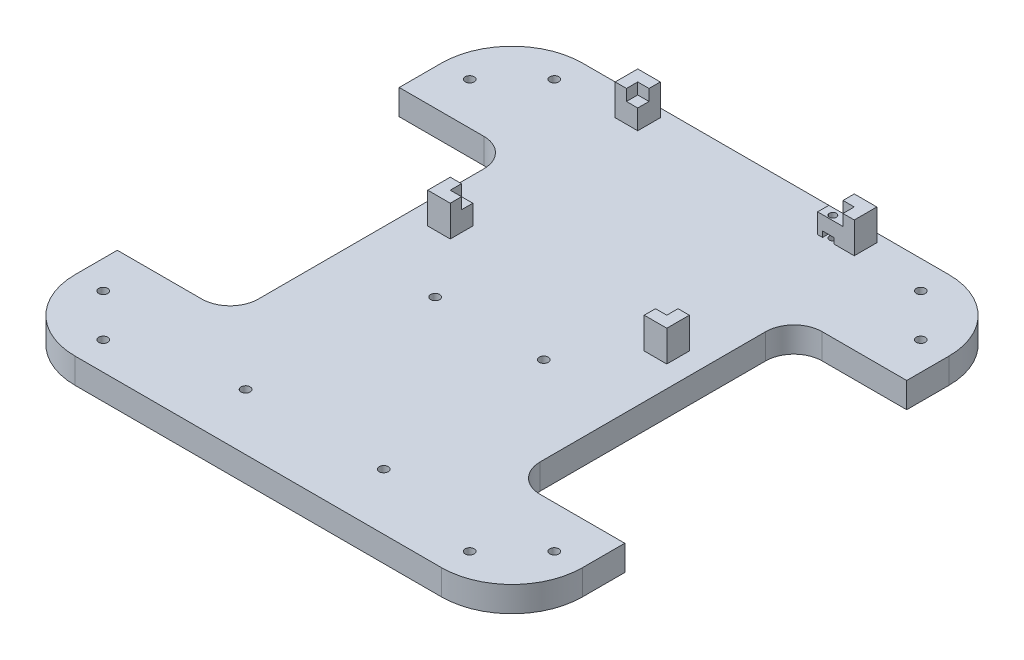
from build123d import *

# Parameters (mm, degrees)
PLATE_DEPTH         = 9
SKETCH3_R           = 1.6
HEX_HOLES_DEPTH     = 128.597021909
SKETCH4_R           = 1.6
ARDUINO_HOLES_DEPTH = 128.597021909
SKETCH5_W           = 40
SKETCH5_H           = 100
CUT_EXTRUDE1_DEPTH  = 128.597021909
FILLET1_R           = 10
BOSS_EXTRUDE1_DEPTH = 11
SKETCH7_W           = 4
SKETCH7_H           = 4
SKETCH7_W_2         = 9
BOSS_EXTRUDE2_DEPTH = 7
SKETCH8_R           = 1.25
CUT_EXTRUDE2_DEPTH  = 129.280941687
SKETCH9_W           = 4
SKETCH9_H           = 2
CUT_EXTRUDE3_DEPTH  = 193.512337267


with BuildPart() as part:
    # Sketch1 → Plate (new body)
    with BuildSketch(Plane(origin=(0, 0, 0), x_dir=(1, 0, 0), z_dir=(0, 1, 0))):
        with BuildLine():
            Line((-65, -90), (65, -90))
            ThreePointArc((65, -90), (82.67766953, -82.67766953), (90, -65))
            Line((90, -65), (90, 65))
            ThreePointArc((90, 65), (82.67766953, 82.67766953), (65, 90))
            Line((65, 90), (-65, 90))
            ThreePointArc((-65, 90), (-82.67766953, 82.67766953), (-90, 65))
            Line((-90, 65), (-90, -65))
            ThreePointArc((-90, -65), (-82.67766953, -82.67766953), (-65, -90))
        make_face()
    extrude(amount=PLATE_DEPTH)

    # Sketch3 → Hex Holes (cut, through all)
    with BuildSketch(Plane(origin=(0, 9, 0), x_dir=(1, 0, 0), z_dir=(0, 1, 0))):
        with Locations((-65, 80)):
            Circle(SKETCH3_R)
        with Locations((-80, 65)):
            Circle(SKETCH3_R)
        with Locations((80, 65)):
            Circle(SKETCH3_R)
        with Locations((80, -65)):
            Circle(SKETCH3_R)
        with Locations((65, 80)):
            Circle(SKETCH3_R)
        with Locations((65, -80)):
            Circle(SKETCH3_R)
        with Locations((-65, -80)):
            Circle(SKETCH3_R)
        with Locations((-80, -65)):
            Circle(SKETCH3_R)
    extrude(amount=-HEX_HOLES_DEPTH, mode=Mode.SUBTRACT)

    # Sketch4 → Arduino Holes (cut, through all)
    with BuildSketch(Plane(origin=(0, 9, 0), x_dir=(1, 0, 0), z_dir=(0, 1, 0))):
        with Locations((-24.5, -70)):
            Circle(SKETCH4_R)
        with Locations((24.5, -70)):
            Circle(SKETCH4_R)
        with Locations((-19.25, -8)):
            Circle(SKETCH4_R)
        with Locations((19.25, -8)):
            Circle(SKETCH4_R)
    extrude(amount=-ARDUINO_HOLES_DEPTH, mode=Mode.SUBTRACT)

    # Sketch5 → Cut-Extrude1 (cut, through all)
    with BuildSketch(Plane(origin=(0, 9, 0), x_dir=(1, 0, 0), z_dir=(0, 1, 0))):
        with Locations((-70, 0)):
            Rectangle(SKETCH5_W, SKETCH5_H)
        with Locations((70, 0)):
            Rectangle(SKETCH5_W, SKETCH5_H)
    extrude(amount=-CUT_EXTRUDE1_DEPTH, mode=Mode.SUBTRACT)

    # Fillet1
    fillet1_edges = [part.edges().sort_by_distance(p)[0] for p in [
        (50, 4.5, -50),
        (50, 4.5, 50),
        (-50, 4.5, -50),
        (-50, 4.5, 50),
    ]]
    fillet(fillet1_edges, radius=FILLET1_R)

    # Sketch6 → Boss-Extrude1 (add)
    with BuildSketch(Plane(origin=(0, 9, 0), x_dir=(1, 0, 0), z_dir=(0, 1, 0))):
        Polygon((34.4, 83), (38.4, 83), (38.4, 79), (42.4, 79), (42.4, 87), (34.4, 87), align=None)
        Polygon((38.4, 20.5), (38.4, 16.5), (34.4, 16.5), (34.4, 12.5), (42.4, 12.5), (42.4, 20.5), align=None)
        Polygon((-38.4, 16.5), (-34.4, 16.5), (-34.4, 12.5), (-42.4, 12.5), (-42.4, 20.5), (-38.4, 20.5), align=None)
        Polygon((-38.4, 83), (-34.4, 83), (-34.4, 87), (-42.4, 87), (-42.4, 79), (-38.4, 79), align=None)
    extrude(amount=BOSS_EXTRUDE1_DEPTH)

    # Sketch7 → Boss-Extrude2 (add)
    with BuildSketch(Plane(origin=(0, 9, 0), x_dir=(1, 0, 0), z_dir=(0, 1, 0))):
        with Locations((-36.4, 18.5)):
            Rectangle(SKETCH7_W, SKETCH7_H)
        with Locations((36.4, 18.5)):
            Rectangle(SKETCH7_W, SKETCH7_H)
        with Locations((-36.4, 81)):
            Rectangle(SKETCH7_W, SKETCH7_H)
        with Locations((33.9, 81)):
            Rectangle(SKETCH7_W_2, SKETCH7_H)
    extrude(amount=BOSS_EXTRUDE2_DEPTH)

    # Sketch8 → Cut-Extrude2 (cut, through all)
    with BuildSketch(Plane(origin=(0, 16, 0), x_dir=(1, 0, 0), z_dir=(0, 1, 0))):
        with Locations((33.15, 80.65)):
            Circle(SKETCH8_R)
    extrude(amount=-CUT_EXTRUDE2_DEPTH, mode=Mode.SUBTRACT)

    # Sketch9 → Cut-Extrude3 (cut, through all)
    with BuildSketch(Plane.XY.offset(-79)):
        with Locations((33.15, 10)):
            Rectangle(SKETCH9_W, SKETCH9_H)
    extrude(amount=-CUT_EXTRUDE3_DEPTH, mode=Mode.SUBTRACT)


solid = part.part
